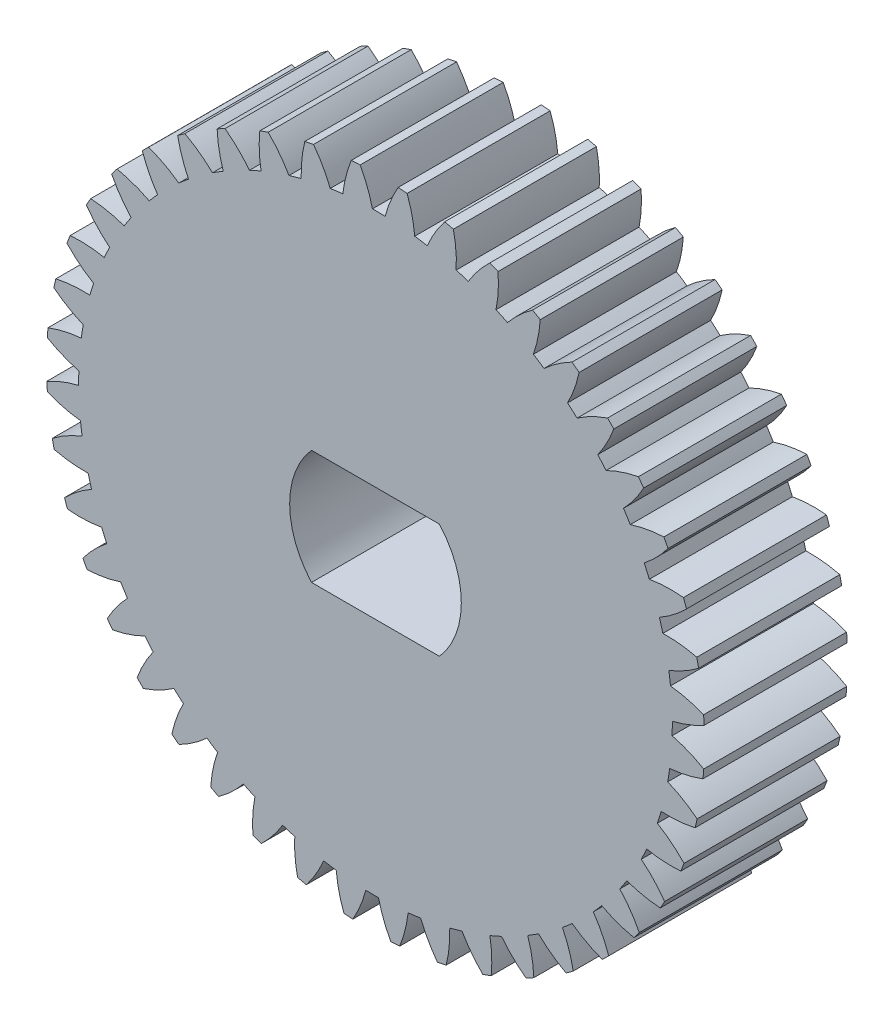
from build123d import *

# Parameters (mm, degrees)
SKETCH1_R               = 57.116275093
BOSS_EXTRUDE1_DEPTH     = 10
CUT_EXTRUDE5_DEPTH      = 304.821337421
CUT_EXTRUDE5_DEPTH_BACK = 304.821337421
SKETCH6_R               = 114.713861219


with BuildPart() as part:
    # Sketch1 → Boss-Extrude1 (new body)
    with BuildSketch(Plane.XY):
        Circle(SKETCH1_R)
    extrude(amount=BOSS_EXTRUDE1_DEPTH)

    # Sketch6 → Cut-Extrude5 (cut, two sides: drawn at the far end of the back side and taken through both)
    # profile 1 of 2: a face of its own
    with BuildSketch(Plane(origin=(-165.342018029, -142.968053491, -42.782329891), x_dir=(1, 0, 0), z_dir=(0, 0, 1)).offset(-CUT_EXTRUDE5_DEPTH_BACK)):
        with Locations((178.511822878, 151.197388201)):
            Circle(SKETCH6_R)
        with BuildLine():
            ThreePointArc((174.18133747, 173.786033493), (174.83665329, 172.784879621), (175.350096936, 171.704081988))
            ThreePointArc((175.350096936, 171.704081988), (175.789344088, 171.767004392), (176.229836357, 171.820519353))
            ThreePointArc((176.229836357, 171.820519353), (176.444429879, 172.997675894), (176.81673005, 174.134839243))
            ThreePointArc((176.81673005, 174.134839243), (177.128294998, 174.155738547), (177.440114969, 174.172405985))
            ThreePointArc((177.440114969, 174.172405985), (177.946281568, 173.08818125), (178.300685557, 171.945313929))
            ThreePointArc((178.300685557, 171.945313929), (178.744416599, 171.945084487), (179.188041264, 171.935366157))
            ThreePointArc((179.188041264, 171.935366157), (179.567977376, 173.070001099), (180.098323287, 174.142605926))
            ThreePointArc((180.098323287, 174.142605926), (180.409691234, 174.11895219), (180.72070935, 174.091073369))
            ThreePointArc((180.72070935, 174.091073369), (181.067422635, 172.945849461), (181.255572325, 171.764177935))
            ThreePointArc((181.255572325, 171.764177935), (181.694754171, 171.700801316), (182.132480315, 171.628047533))
            ThreePointArc((182.132480315, 171.628047533), (182.670024613, 172.697062981), (183.34761995, 173.683274145))
            ThreePointArc((183.34761995, 173.683274145), (183.652452342, 173.615548891), (183.956337173, 173.543691343))
            ThreePointArc((183.956337173, 173.543691343), (184.136539062, 172.360781718), (184.154604267, 171.164361412))
            ThreePointArc((184.154604267, 171.164361412), (184.580296442, 171.039127782), (185.003213221, 170.904819602))
            ThreePointArc((185.003213221, 170.904819602), (185.687422854, 171.886453484), (186.49847373, 172.76619457))
            ThreePointArc((186.49847373, 172.76619457), (186.790565059, 172.655776488), (187.081130385, 172.541403026))
            ThreePointArc((187.081130385, 172.541403026), (187.091152487, 171.344888313), (186.938765452, 170.158074894))
            ThreePointArc((186.938765452, 170.158074894), (187.34230209, 169.973533649), (187.74180014, 169.780405199))
            ThreePointArc((187.74180014, 169.780405199), (188.558746573, 170.65467428), (189.48674233, 171.410036296))
            ThreePointArc((189.48674233, 171.410036296), (189.76014646, 171.259173182), (190.031477209, 171.104612119))
            ThreePointArc((190.031477209, 171.104612119), (189.871115502, 169.918849906), (189.551378387, 168.765803473))
            ThreePointArc((189.551378387, 168.765803473), (189.924544647, 168.52571134), (190.292491339, 168.277694159))
            ThreePointArc((190.292491339, 168.277694159), (191.225543898, 169.026800842), (192.251593219, 169.642406796))
            ThreePointArc((192.251593219, 169.642406796), (192.500744429, 169.454169786), (192.74731709, 169.26256754))
            ThreePointArc((192.74731709, 169.26256754), (192.419836076, 168.111696528), (191.939257808, 167.01588978))
            ThreePointArc((191.939257808, 167.01588978), (192.274457101, 166.725134343), (192.6033621, 166.427277346))
            ThreePointArc((192.6033621, 166.427277346), (193.633526526, 167.035971979), (194.736742007, 167.499289908))
            ThreePointArc((194.736742007, 167.499289908), (194.956568297, 167.277510965), (195.173363361, 167.052768006))
            ThreePointArc((195.173363361, 167.052768006), (194.68542961, 165.960216608), (194.053793375, 164.943957012))
            ThreePointArc((194.053793375, 164.943957012), (194.344202009, 164.608457213), (194.62736976, 164.266823909))
            ThreePointArc((194.62736976, 164.266823909), (195.733674875, 164.722715224), (196.891598229, 165.024313313))
            ThreePointArc((196.891598229, 165.024313313), (197.077624571, 164.773507216), (197.260228715, 164.520198662))
            ThreePointArc((197.260228715, 164.520198662), (196.621775151, 163.508208075), (195.851939242, 162.592183744))
            ThreePointArc((195.851939242, 162.592183744), (196.091645336, 162.218769392), (196.323311358, 161.84031445))
            ThreePointArc((196.323311358, 161.84031445), (197.483235982, 162.134121815), (198.672295229, 162.267860395))
            ThreePointArc((198.672295229, 162.267860395), (198.820734661, 161.993132835), (198.965430593, 161.716415317))
            ThreePointArc((198.965430593, 161.716415317), (198.189454289, 160.805586751), (197.297090345, 160.0084453))
            ThreePointArc((197.297090345, 160.0084453), (197.481214173, 159.604718033), (197.656662415, 159.197145704))
            ThreePointArc((197.656662415, 159.197145704), (198.846593826, 159.322888049), (200.042583149, 159.286044589))
            ThreePointArc((200.042583149, 159.286044589), (200.150413874, 158.992988225), (200.254256001, 158.698494914))
            ThreePointArc((200.254256001, 158.698494914), (199.356553596, 157.907370212), (198.359827575, 157.245339141))
            ThreePointArc((198.359827575, 157.245339141), (198.484620907, 156.819517684), (198.600279749, 156.391124965))
            ThreePointArc((198.600279749, 156.391124965), (199.795994375, 156.346242538), (200.97456688, 156.139567064))
            ThreePointArc((200.97456688, 156.139567064), (201.039593774, 155.834147679), (201.10046817, 155.52787361))
            ThreePointArc((201.10046817, 155.52787361), (200.099314298, 154.872557789), (199.018516665, 154.359114143))
            ThreePointArc((199.018516665, 154.359114143), (199.081439069, 153.919866991), (199.13495403, 153.479374722))
            ThreePointArc((199.13495403, 153.479374722), (200.312110571, 153.2647812), (201.44927392, 152.892481029))
            ThreePointArc((201.44927392, 152.892481029), (201.470173224, 152.580916081), (201.486840662, 152.269096111))
            ThreePointArc((201.486840662, 152.269096111), (200.402615928, 151.762929511), (199.259748607, 151.408525522))
            ThreePointArc((199.259748607, 151.408525522), (199.259519164, 150.964794481), (199.249800834, 150.521169815))
            ThreePointArc((199.249800834, 150.521169815), (200.384435776, 150.141233703), (201.457040603, 149.610887793))
            ThreePointArc((201.457040603, 149.610887793), (201.433386867, 149.299519846), (201.405508046, 148.988501729))
            ThreePointArc((201.405508046, 148.988501729), (200.260284138, 148.641788444), (199.078612613, 148.453638754))
            ThreePointArc((199.078612613, 148.453638754), (199.015235994, 148.014456908), (198.94248221, 147.576730765))
            ThreePointArc((198.94248221, 147.576730765), (200.011497658, 147.039186466), (200.997708822, 146.36159113))
            ThreePointArc((200.997708822, 146.36159113), (200.929983568, 146.056758737), (200.85812602, 145.752873906))
            ThreePointArc((200.85812602, 145.752873906), (199.675216395, 145.572672018), (198.478796089, 145.554606812))
            ThreePointArc((198.478796089, 145.554606812), (198.35356246, 145.128914638), (198.219254279, 144.705997858))
            ThreePointArc((198.219254279, 144.705997858), (199.200888161, 144.021788225), (200.080629247, 143.21073735))
            ThreePointArc((200.080629247, 143.21073735), (199.970211166, 142.91864602), (199.855837703, 142.628080694))
            ThreePointArc((199.855837703, 142.628080694), (198.65932299, 142.618058593), (197.472509571, 142.770445627))
            ThreePointArc((197.472509571, 142.770445627), (197.287968326, 142.366908989), (197.094839876, 141.967410939))
            ThreePointArc((197.094839876, 141.967410939), (197.969108958, 141.150464507), (198.724470974, 140.222468749))
            ThreePointArc((198.724470974, 140.222468749), (198.573607859, 139.94906462), (198.419046796, 139.677733871))
            ThreePointArc((198.419046796, 139.677733871), (197.233284584, 139.838095577), (196.08023815, 140.157832692))
            ThreePointArc((196.08023815, 140.157832692), (195.840146018, 139.784666432), (195.592128837, 139.416719741))
            ThreePointArc((195.592128837, 139.416719741), (196.34123552, 138.483667182), (196.956841474, 137.45761786))
            ThreePointArc((196.956841474, 137.45761786), (196.768604463, 137.20846665), (196.577002217, 136.961893989))
            ThreePointArc((196.577002217, 136.961893989), (195.426131205, 137.289375003), (194.330324457, 137.769953271))
            ThreePointArc((194.330324457, 137.769953271), (194.039569021, 137.434753979), (193.741712023, 137.105848979))
            ThreePointArc((193.741712023, 137.105848979), (194.350406656, 136.075684553), (194.813724586, 134.972469073))
            ThreePointArc((194.813724586, 134.972469073), (194.591945643, 134.752642782), (194.367202683, 134.535847719))
            ThreePointArc((194.367202683, 134.535847719), (193.274651286, 135.023781469), (192.258391689, 135.655417704))
            ThreePointArc((192.258391689, 135.655417704), (191.922891891, 135.36500907), (191.581258586, 135.08184132))
            ThreePointArc((191.581258586, 135.08184132), (192.037149902, 133.975536204), (192.33874799, 132.81761285))
            ThreePointArc((192.33874799, 132.81761285), (192.087941894, 132.631586509), (191.834633339, 132.448982364))
            ThreePointArc((191.834633339, 132.448982364), (190.822642753, 133.087435928), (189.906618422, 133.857271837))
            ThreePointArc((189.906618422, 133.857271837), (189.53320407, 133.617565743), (189.154749127, 133.385899721))
            ThreePointArc((189.154749127, 133.385899721), (189.448556493, 132.225975098), (189.582295073, 131.03691585))
            ThreePointArc((189.582295073, 131.03691585), (189.307567512, 130.888476418), (189.030849994, 130.743780486))
            ThreePointArc((189.030849994, 130.743780486), (188.120021428, 131.519756791), (187.322879977, 132.412120734))
            ThreePointArc((187.322879977, 132.412120734), (186.919152711, 132.227996906), (186.511580381, 132.052548664))
            ThreePointArc((186.511580381, 132.052548664), (186.637322727, 130.862617253), (186.600479266, 129.66662793))
            ThreePointArc((186.600479266, 129.66662793), (186.307422902, 129.558797205), (186.012929591, 129.454955078))
            ThreePointArc((186.012929591, 129.454955078), (185.221804889, 130.352657483), (184.559773819, 131.349383505))
            ThreePointArc((184.559773819, 131.349383505), (184.133952361, 131.224590173), (183.705559642, 131.108931331))
            ThreePointArc((183.705559642, 131.108931331), (183.660677215, 129.913216704), (183.454001741, 128.734644199))
            ThreePointArc((183.454001741, 128.734644199), (183.148582356, 128.669617305), (182.842308287, 128.608742909))
            ThreePointArc((182.842308287, 128.608742909), (182.186992466, 129.609896781), (181.67354882, 130.690694414))
            ThreePointArc((181.67354882, 130.690694414), (181.234301668, 130.62777201), (180.7938094, 130.574257049))
            ThreePointArc((180.7938094, 130.574257049), (180.579215878, 129.397100508), (180.206915706, 128.259937159))
            ThreePointArc((180.206915706, 128.259937159), (179.895350759, 128.239037855), (179.583530788, 128.222370417))
            ThreePointArc((179.583530788, 128.222370417), (179.077364189, 129.306595152), (178.722960199, 130.449462473))
            ThreePointArc((178.722960199, 130.449462473), (178.279229158, 130.449691915), (177.835604493, 130.459410245))
            ThreePointArc((177.835604493, 130.459410245), (177.455668381, 129.324775303), (176.92532247, 128.252170476))
            ThreePointArc((176.92532247, 128.252170476), (176.613954523, 128.275824212), (176.302936407, 128.303703033))
            ThreePointArc((176.302936407, 128.303703033), (175.956223121, 129.448926941), (175.768073431, 130.630598467))
            ThreePointArc((175.768073431, 130.630598467), (175.328891585, 130.693975085), (174.891165442, 130.766728869))
            ThreePointArc((174.891165442, 130.766728869), (174.353621143, 129.697713421), (173.676025807, 128.711502257))
            ThreePointArc((173.676025807, 128.711502257), (173.371193414, 128.779227511), (173.067308584, 128.851085059))
            ThreePointArc((173.067308584, 128.851085059), (172.887106695, 130.033994684), (172.86904149, 131.23041499))
            ThreePointArc((172.86904149, 131.23041499), (172.443349315, 131.35564862), (172.020432536, 131.4899568))
            ThreePointArc((172.020432536, 131.4899568), (171.336222902, 130.508322918), (170.525172027, 129.628581832))
            ThreePointArc((170.525172027, 129.628581832), (170.233080697, 129.738999913), (169.942515371, 129.853373376))
            ThreePointArc((169.942515371, 129.853373376), (169.93249327, 131.049888089), (170.084880305, 132.236701508))
            ThreePointArc((170.084880305, 132.236701508), (169.681343666, 132.421242753), (169.281845617, 132.614371203))
            ThreePointArc((169.281845617, 132.614371203), (168.464899184, 131.740102122), (167.536903427, 130.984740106))
            ThreePointArc((167.536903427, 130.984740106), (167.263499297, 131.13560322), (166.992168548, 131.290164283))
            ThreePointArc((166.992168548, 131.290164283), (167.152530255, 132.475926495), (167.472267369, 133.628972929))
            ThreePointArc((167.472267369, 133.628972929), (167.099101109, 133.869065062), (166.731154418, 134.117082243))
            ThreePointArc((166.731154418, 134.117082243), (165.798101859, 133.367975559), (164.772052537, 132.752369606))
            ThreePointArc((164.772052537, 132.752369606), (164.522901327, 132.940606616), (164.276328667, 133.132208862))
            ThreePointArc((164.276328667, 133.132208862), (164.60380968, 134.283079874), (165.084387948, 135.378886622))
            ThreePointArc((165.084387948, 135.378886622), (164.749188656, 135.669642059), (164.420283657, 135.967499056))
            ThreePointArc((164.420283657, 135.967499056), (163.390119231, 135.358804423), (162.28690375, 134.895486494))
            ThreePointArc((162.28690375, 134.895486494), (162.06707746, 135.117265437), (161.850282396, 135.342008396))
            ThreePointArc((161.850282396, 135.342008396), (162.338216147, 136.434559793), (162.969852381, 137.45081939))
            ThreePointArc((162.969852381, 137.45081939), (162.679443747, 137.786319189), (162.396275997, 138.127952493))
            ThreePointArc((162.396275997, 138.127952493), (161.289970881, 137.672061178), (160.132047527, 137.370463089))
            ThreePointArc((160.132047527, 137.370463089), (159.946021186, 137.621269185), (159.763417041, 137.87457774))
            ThreePointArc((159.763417041, 137.87457774), (160.401870606, 138.886568327), (161.171706514, 139.802592657))
            ThreePointArc((161.171706514, 139.802592657), (160.932000421, 140.17600701), (160.700334398, 140.554461952))
            ThreePointArc((160.700334398, 140.554461952), (159.540409775, 140.260654586), (158.351350528, 140.126916007))
            ThreePointArc((158.351350528, 140.126916007), (158.202911096, 140.401643567), (158.058215164, 140.678361085))
            ThreePointArc((158.058215164, 140.678361085), (158.834191468, 141.589189651), (159.726555411, 142.386331102))
            ThreePointArc((159.726555411, 142.386331102), (159.542431584, 142.790058369), (159.366983341, 143.197630698))
            ThreePointArc((159.366983341, 143.197630698), (158.17705193, 143.071888353), (156.981062607, 143.108731813))
            ThreePointArc((156.981062607, 143.108731813), (156.873231883, 143.401788177), (156.769389756, 143.696281488))
            ThreePointArc((156.769389756, 143.696281488), (157.66709216, 144.48740619), (158.663818182, 145.14943726))
            ThreePointArc((158.663818182, 145.14943726), (158.53902485, 145.575258718), (158.423366008, 146.003651437))
            ThreePointArc((158.423366008, 146.003651437), (157.227651381, 146.048533864), (156.049078877, 146.255209338))
            ThreePointArc((156.049078877, 146.255209338), (155.984051982, 146.560628723), (155.923177586, 146.866902792))
            ThreePointArc((155.923177586, 146.866902792), (156.924331459, 147.522218613), (158.005129091, 148.035662259))
            ThreePointArc((158.005129091, 148.035662259), (157.942206687, 148.474909411), (157.888691726, 148.915401679))
            ThreePointArc((157.888691726, 148.915401679), (156.711535186, 149.129995202), (155.574371836, 149.502295373))
            ThreePointArc((155.574371836, 149.502295373), (155.553472532, 149.813860321), (155.536805095, 150.125680291))
            ThreePointArc((155.536805095, 150.125680291), (156.621029829, 150.63184689), (157.76389715, 150.98625088))
            ThreePointArc((157.76389715, 150.98625088), (157.764126593, 151.429981921), (157.773844923, 151.873606587))
            ThreePointArc((157.773844923, 151.873606587), (156.639209981, 152.253542699), (155.566605153, 152.783888609))
            ThreePointArc((155.566605153, 152.783888609), (155.590258889, 153.095256556), (155.618137711, 153.406274673))
            ThreePointArc((155.618137711, 153.406274673), (156.763361618, 153.752987958), (157.945033144, 153.941137648))
            ThreePointArc((157.945033144, 153.941137648), (158.008409763, 154.380319494), (158.081163547, 154.818045637))
            ThreePointArc((158.081163547, 154.818045637), (157.012148099, 155.355589936), (156.025936934, 156.033185272))
            ThreePointArc((156.025936934, 156.033185272), (156.093662188, 156.338017665), (156.165519737, 156.641902496))
            ThreePointArc((156.165519737, 156.641902496), (157.348429361, 156.822104384), (158.544849668, 156.84016959))
            ThreePointArc((158.544849668, 156.84016959), (158.670083297, 157.265861764), (158.804391478, 157.688778544))
            ThreePointArc((158.804391478, 157.688778544), (157.822757595, 158.372988177), (156.943016509, 159.184039052))
            ThreePointArc((156.943016509, 159.184039052), (157.053434591, 159.476130382), (157.167808053, 159.766695708))
            ThreePointArc((157.167808053, 159.766695708), (158.364322766, 159.776717809), (159.551136186, 159.624330775))
            ThreePointArc((159.551136186, 159.624330775), (159.73567743, 160.027867413), (159.92880588, 160.427365462))
            ThreePointArc((159.92880588, 160.427365462), (159.054536799, 161.244311895), (158.299174783, 162.172307653))
            ThreePointArc((158.299174783, 162.172307653), (158.450037898, 162.445711782), (158.604598961, 162.717042531))
            ThreePointArc((158.604598961, 162.717042531), (159.790361173, 162.556680824), (160.943407607, 162.23694371))
            ThreePointArc((160.943407607, 162.23694371), (161.183499739, 162.61010997), (161.43151692, 162.978056661))
            ThreePointArc((161.43151692, 162.978056661), (160.682410237, 163.91110922), (160.066804283, 164.937158542))
            ThreePointArc((160.066804283, 164.937158542), (160.255041293, 165.186309752), (160.446643539, 165.432882413))
            ThreePointArc((160.446643539, 165.432882413), (161.597514551, 165.105401399), (162.693321299, 164.624823131))
            ThreePointArc((162.693321299, 164.624823131), (162.984076736, 164.960022423), (163.281933734, 165.288927423))
            ThreePointArc((163.281933734, 165.288927423), (162.6732391, 166.319091849), (162.209921171, 167.422307329))
            ThreePointArc((162.209921171, 167.422307329), (162.431700114, 167.64213362), (162.656443074, 167.858928683))
            ThreePointArc((162.656443074, 167.858928683), (163.748994471, 167.370994932), (164.765254068, 166.739358698))
            ThreePointArc((164.765254068, 166.739358698), (165.100753866, 167.029767332), (165.442387171, 167.312935082))
            ThreePointArc((165.442387171, 167.312935082), (164.986495855, 168.419240198), (164.684897767, 169.577163552))
            ThreePointArc((164.684897767, 169.577163552), (164.935703863, 169.763189893), (165.189012418, 169.945794038))
            ThreePointArc((165.189012418, 169.945794038), (166.201003004, 169.307340474), (167.117027335, 168.537504565))
            ThreePointArc((167.117027335, 168.537504565), (167.490441687, 168.777210658), (167.86889663, 169.008876681))
            ThreePointArc((167.86889663, 169.008876681), (167.575089264, 170.168801304), (167.441350684, 171.357860551))
            ThreePointArc((167.441350684, 171.357860551), (167.716078245, 171.506299984), (167.992795763, 171.650995916))
            ThreePointArc((167.992795763, 171.650995916), (168.903624328, 170.875019611), (169.70076578, 169.982655668))
            ThreePointArc((169.70076578, 169.982655668), (170.104493046, 170.166779496), (170.512065376, 170.342227738))
            ThreePointArc((170.512065376, 170.342227738), (170.38632303, 171.532159149), (170.423166491, 172.728148472))
            ThreePointArc((170.423166491, 172.728148472), (170.716222855, 172.835979196), (171.010716166, 172.939821323))
            ThreePointArc((171.010716166, 172.939821323), (171.801840868, 172.042118919), (172.463871938, 171.045392897))
            ThreePointArc((172.463871938, 171.045392897), (172.889693396, 171.170186229), (173.318086115, 171.285845071))
            ThreePointArc((173.318086115, 171.285845071), (173.362968541, 172.481559698), (173.569644016, 173.660132203))
            ThreePointArc((173.569644016, 173.660132203), (173.875063401, 173.725159097), (174.18133747, 173.786033493))
        make_face(mode=Mode.SUBTRACT)
    # profile 2 of 2: a face of its own
    with BuildSketch(Plane(origin=(-165.342018029, -142.968053491, -42.782329891), x_dir=(1, 0, 0), z_dir=(0, 0, 1)).offset(-CUT_EXTRUDE5_DEPTH_BACK)):
        with BuildLine():
            Line((182.983958833, 155.197388201), (174.039686923, 155.197388201))
            ThreePointArc((174.039686923, 155.197388201), (172.511822878, 151.197388201), (174.039686923, 147.197388201))
            Line((174.039686923, 147.197388201), (182.983958833, 147.197388201))
            ThreePointArc((182.983958833, 147.197388201), (184.511822878, 151.197388201), (182.983958833, 155.197388201))
        make_face()
    extrude(amount=CUT_EXTRUDE5_DEPTH + CUT_EXTRUDE5_DEPTH_BACK, mode=Mode.SUBTRACT)


solid = part.part
